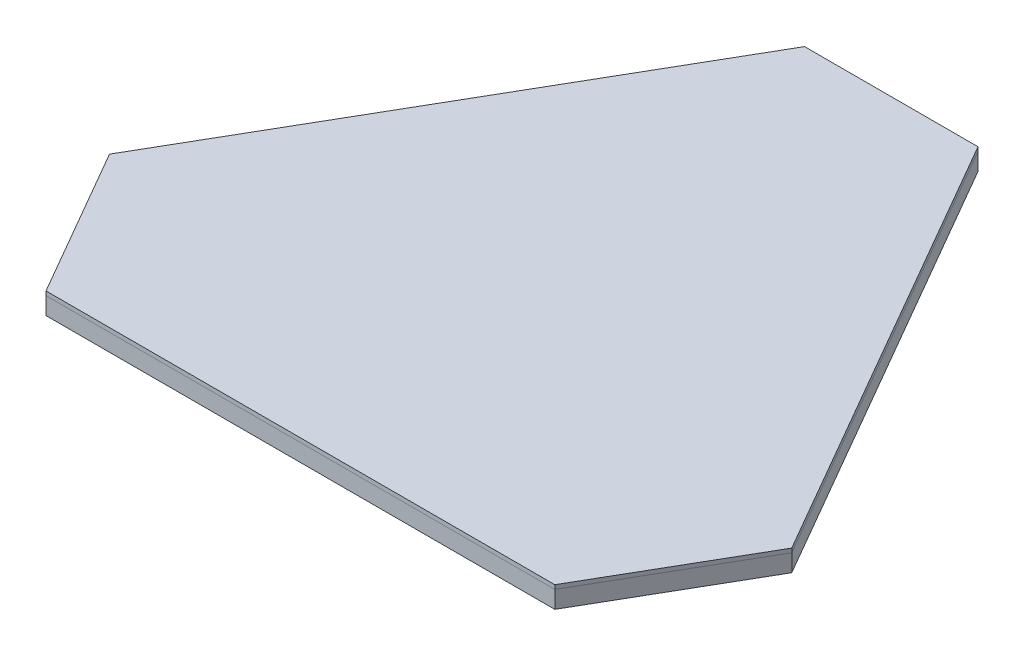
from build123d import *

# Parameters (mm, degrees)
RSC_START                   = -6.35
RSC_0_5_X_0_5_IN_1_DEPTH    = 12.7
RSC_0_5_X_0_5_IN_1_2_DEPTH  = 1
RSC_START_2                 = 5.35
RSC_0_5_X_0_5_IN_1_3_DEPTH  = 1
RSC_0_5_X_0_5_IN_1_4_DEPTH  = 12.7
RSC_0_5_X_0_5_IN_1_5_DEPTH  = 1
RSC_0_5_X_0_5_IN_1_6_DEPTH  = 1
RSC_0_5_X_0_5_IN_1_7_DEPTH  = 12.7
RSC_0_5_X_0_5_IN_1_8_DEPTH  = 1
RSC_0_5_X_0_5_IN_1_9_DEPTH  = 1
RSC_0_5_X_0_5_IN_1_10_DEPTH = 12.7
RSC_0_5_X_0_5_IN_1_11_DEPTH = 1
RSC_0_5_X_0_5_IN_1_12_DEPTH = 1
RSC_0_5_X_0_5_IN_1_13_DEPTH = 12.7
RSC_0_5_X_0_5_IN_1_14_DEPTH = 1
RSC_0_5_X_0_5_IN_1_15_DEPTH = 1
RSC_0_5_X_0_5_IN_1_16_DEPTH = 12.7
RSC_0_5_X_0_5_IN_1_17_DEPTH = 1
RSC_0_5_X_0_5_IN_1_18_DEPTH = 1
RSC_0_5_X_0_5_IN_1_19_DEPTH = 12.7
RSC_0_5_X_0_5_IN_1_20_DEPTH = 1
RSC_0_5_X_0_5_IN_1_21_DEPTH = 1
RSC_0_5_X_0_5_IN_1_22_DEPTH = 12.7
RSC_0_5_X_0_5_IN_1_23_DEPTH = 1
RSC_0_5_X_0_5_IN_1_24_DEPTH = 1
RSC_0_5_X_0_5_IN_1_25_DEPTH = 12.7
RSC_0_5_X_0_5_IN_1_26_DEPTH = 1
RSC_0_5_X_0_5_IN_1_27_DEPTH = 1
RSC_0_5_X_0_5_IN_1_28_DEPTH = 12.7
RSC_0_5_X_0_5_IN_1_29_DEPTH = 1
RSC_0_5_X_0_5_IN_1_30_DEPTH = 1
SKETCH12_R                  = 3.5
CUT_EXTRUDE1_DEPTH          = 356.811003808
CUT_EXTRUDE3_REACH          = 505.683
SKETCH14_R                  = 2
CUT_EXTRUDE5_REACH          = 491.99
SKETCH16_R                  = 2.5
CUT_EXTRUDE6_REACH          = 495.439
SKETCH17_R                  = 2.5
BOSS_EXTRUDE1_DEPTH         = 3


# Read off the part's stored shape, not the designer's step: Rsc 0.5 X 0.5 IN(1)
with BuildPart() as part:
    # Rsc 0.5 X 0.5 IN(1) outline → Rsc 0.5 X 0.5 IN(1) (new body)
    with BuildSketch(Plane(origin=(0, 0, 0), x_dir=(1, 0, 0), z_dir=(0, 1, 0)).offset(RSC_START)):
        Polygon((63.666174209, 252.426951546), (-63.666174209, 252.426951546), (-63.08882394, 251.426951546), (63.08882394, 251.426951546), align=None)
        Polygon((56.91117606, 240.726951546), (-56.91117606, 240.726951546), (-56.333825791, 239.726951546), (56.333825791, 239.726951546), align=None)
    extrude(amount=RSC_0_5_X_0_5_IN_1_DEPTH)

    # Rsc 0.5 X 0.5 IN_1 2 outline → Rsc 0.5 X 0.5 IN_1 2 (add)
    with BuildSketch(Plane(origin=(0, 0, 0), x_dir=(1, 0, 0), z_dir=(0, 1, 0)).offset(RSC_START)):
        Polygon((63.08882394, 251.426951546), (-63.08882394, 251.426951546), (-56.91117606, 240.726951546), (56.91117606, 240.726951546), align=None)
    extrude(amount=RSC_0_5_X_0_5_IN_1_2_DEPTH)

    # Rsc 0.5 X 0.5 IN_1 3 outline → Rsc 0.5 X 0.5 IN_1 3 (add)
    with BuildSketch(Plane(origin=(0, 0, 0), x_dir=(1, 0, 0), z_dir=(0, 1, 0)).offset(RSC_START_2)):
        Polygon((63.08882394, 251.426951546), (-63.08882394, 251.426951546), (-56.91117606, 240.726951546), (56.91117606, 240.726951546), align=None)
    extrude(amount=RSC_0_5_X_0_5_IN_1_3_DEPTH)


with BuildPart() as body_2:
    # Rsc 0.5 X 0.5 IN_1 4 outline → Rsc 0.5 X 0.5 IN_1 4 (new body)
    with BuildSketch(Plane(origin=(0, 0, 0), x_dir=(1, 0, 0), z_dir=(0, 1, 0)).offset(RSC_START)):
        Polygon((-63.666174209, 252.426951546), (-250.441239743, -71.076951546), (-249.286539205, -71.076951546), (-63.08882394, 251.426951546), align=None)
        Polygon((-56.91117606, 240.726951546), (-236.931243444, -71.076951546), (-235.776542906, -71.076951546), (-56.333825791, 239.726951546), align=None)
    extrude(amount=RSC_0_5_X_0_5_IN_1_4_DEPTH)

    # Rsc 0.5 X 0.5 IN_1 5 outline → Rsc 0.5 X 0.5 IN_1 5 (add)
    with BuildSketch(Plane(origin=(0, 0, 0), x_dir=(1, 0, 0), z_dir=(0, 1, 0)).offset(RSC_START)):
        Polygon((-63.08882394, 251.426951546), (-249.286539205, -71.076951546), (-236.931243444, -71.076951546), (-56.91117606, 240.726951546), align=None)
    extrude(amount=RSC_0_5_X_0_5_IN_1_5_DEPTH)

    # Rsc 0.5 X 0.5 IN_1 6 outline → Rsc 0.5 X 0.5 IN_1 6 (add)
    with BuildSketch(Plane(origin=(0, 0, 0), x_dir=(1, 0, 0), z_dir=(0, 1, 0)).offset(RSC_START_2)):
        Polygon((-63.08882394, 251.426951546), (-249.286539205, -71.076951546), (-236.931243444, -71.076951546), (-56.91117606, 240.726951546), align=None)
    extrude(amount=RSC_0_5_X_0_5_IN_1_6_DEPTH)

    # Cut-Extrude5: up to this face of the body (flat: up to its plane)
    cut_extrude5_end = Plane(body_2.part.faces().sort_by_distance((-146.055184349, 0, -84.325))[0])
    # Sketch16 → Cut-Extrude5 (cut, up to the picked face)
    with BuildSketch(Plane(origin=(-157.053706976, 0, -90.675), x_dir=(-0.4999999999999974, 0, 0.8660254037844403), z_dir=(-0.8660254037844402, 0, -0.49999999999999734)), mode=Mode.PRIVATE) as cut_extrude5_sk1:
        with Locations((-46.775065534, 0)):
            Circle(SKETCH16_R)
    cut_extrude5_tool1 = split(extrude(cut_extrude5_sk1.sketch, amount=-CUT_EXTRUDE5_REACH, mode=Mode.PRIVATE), bisect_by=cut_extrude5_end, keep=Keep.BOTH, mode=Mode.PRIVATE)
    # Sketch16 → Cut-Extrude5 (cut, up to the picked face)
    with BuildSketch(Plane(origin=(-157.053706976, 0, -90.675), x_dir=(-0.4999999999999974, 0, 0.8660254037844403), z_dir=(-0.8660254037844402, 0, -0.49999999999999734)), mode=Mode.PRIVATE) as cut_extrude5_sk2:
        with Locations((-14.775065534, 0)):
            Circle(SKETCH16_R)
    cut_extrude5_tool2 = split(extrude(cut_extrude5_sk2.sketch, amount=-CUT_EXTRUDE5_REACH, mode=Mode.PRIVATE), bisect_by=cut_extrude5_end, keep=Keep.BOTH, mode=Mode.PRIVATE)
    add(cut_extrude5_tool1.solids().sort_by(Axis((-133.666174, 0, -131.183395), (0.8660254037844402, 0, 0.49999999999999734)))[0], mode=Mode.SUBTRACT)
    add(cut_extrude5_tool2.solids().sort_by(Axis((-149.666174, 0, -103.470582), (0.8660254037844402, 0, 0.49999999999999734)))[0], mode=Mode.SUBTRACT)


with BuildPart() as body_3:
    # Rsc 0.5 X 0.5 IN_1 7 outline → Rsc 0.5 X 0.5 IN_1 7 (new body)
    with BuildSketch(Plane(origin=(0, 0, 0), x_dir=(1, 0, 0), z_dir=(0, 1, 0)).offset(RSC_START)):
        Polygon((250.441239743, -71.076951546), (63.666174209, 252.426951546), (63.08882394, 251.426951546), (249.286539205, -71.076951546), align=None)
        Polygon((236.931243444, -71.076951546), (56.91117606, 240.726951546), (56.333825791, 239.726951546), (235.776542906, -71.076951546), align=None)
    extrude(amount=RSC_0_5_X_0_5_IN_1_7_DEPTH)

    # Rsc 0.5 X 0.5 IN_1 8 outline → Rsc 0.5 X 0.5 IN_1 8 (add)
    with BuildSketch(Plane(origin=(0, 0, 0), x_dir=(1, 0, 0), z_dir=(0, 1, 0)).offset(RSC_START)):
        Polygon((249.286539205, -71.076951546), (63.08882394, 251.426951546), (56.91117606, 240.726951546), (236.931243444, -71.076951546), align=None)
    extrude(amount=RSC_0_5_X_0_5_IN_1_8_DEPTH)

    # Rsc 0.5 X 0.5 IN_1 9 outline → Rsc 0.5 X 0.5 IN_1 9 (add)
    with BuildSketch(Plane(origin=(0, 0, 0), x_dir=(1, 0, 0), z_dir=(0, 1, 0)).offset(RSC_START_2)):
        Polygon((249.286539205, -71.076951546), (63.08882394, 251.426951546), (56.91117606, 240.726951546), (236.931243444, -71.076951546), align=None)
    extrude(amount=RSC_0_5_X_0_5_IN_1_9_DEPTH)


with BuildPart() as body_4:
    # Rsc 0.5 X 0.5 IN_1 10 outline → Rsc 0.5 X 0.5 IN_1 10 (new body)
    with BuildSketch(Plane(origin=(0, 0, 0), x_dir=(1, 0, 0), z_dir=(0, 1, 0)).offset(RSC_START)):
        Polygon((186.775065534, -181.35), (250.441239743, -71.076951546), (249.286539205, -71.076951546), (186.197715265, -180.35), align=None)
        Polygon((180.020067384, -169.65), (236.931243444, -71.076951546), (235.776542906, -71.076951546), (179.442717115, -168.65), align=None)
    extrude(amount=RSC_0_5_X_0_5_IN_1_10_DEPTH)

    # Rsc 0.5 X 0.5 IN_1 11 outline → Rsc 0.5 X 0.5 IN_1 11 (add)
    with BuildSketch(Plane(origin=(0, 0, 0), x_dir=(1, 0, 0), z_dir=(0, 1, 0)).offset(RSC_START)):
        Polygon((186.197715265, -180.35), (249.286539205, -71.076951546), (236.931243444, -71.076951546), (180.020067384, -169.65), align=None)
    extrude(amount=RSC_0_5_X_0_5_IN_1_11_DEPTH)

    # Rsc 0.5 X 0.5 IN_1 12 outline → Rsc 0.5 X 0.5 IN_1 12 (add)
    with BuildSketch(Plane(origin=(0, 0, 0), x_dir=(1, 0, 0), z_dir=(0, 1, 0)).offset(RSC_START_2)):
        Polygon((186.197715265, -180.35), (249.286539205, -71.076951546), (236.931243444, -71.076951546), (180.020067384, -169.65), align=None)
    extrude(amount=RSC_0_5_X_0_5_IN_1_12_DEPTH)


with BuildPart() as body_5:
    # Rsc 0.5 X 0.5 IN_1 13 outline → Rsc 0.5 X 0.5 IN_1 13 (new body)
    with BuildSketch(Plane(origin=(0, 0, 0), x_dir=(1, 0, 0), z_dir=(0, 1, 0)).offset(RSC_START)):
        Polygon((-186.775065534, -181.35), (186.775065534, -181.35), (186.197715265, -180.35), (-186.197715265, -180.35), align=None)
        Polygon((-180.020067384, -169.65), (180.020067384, -169.65), (179.442717115, -168.65), (-179.442717115, -168.65), align=None)
    extrude(amount=RSC_0_5_X_0_5_IN_1_13_DEPTH)

    # Rsc 0.5 X 0.5 IN_1 14 outline → Rsc 0.5 X 0.5 IN_1 14 (add)
    with BuildSketch(Plane(origin=(0, 0, 0), x_dir=(1, 0, 0), z_dir=(0, 1, 0)).offset(RSC_START)):
        Polygon((-186.197715265, -180.35), (186.197715265, -180.35), (180.020067384, -169.65), (-180.020067384, -169.65), align=None)
    extrude(amount=RSC_0_5_X_0_5_IN_1_14_DEPTH)

    # Rsc 0.5 X 0.5 IN_1 15 outline → Rsc 0.5 X 0.5 IN_1 15 (add)
    with BuildSketch(Plane(origin=(0, 0, 0), x_dir=(1, 0, 0), z_dir=(0, 1, 0)).offset(RSC_START_2)):
        Polygon((-186.197715265, -180.35), (186.197715265, -180.35), (180.020067384, -169.65), (-180.020067384, -169.65), align=None)
    extrude(amount=RSC_0_5_X_0_5_IN_1_15_DEPTH)


with BuildPart() as body_6:
    # Rsc 0.5 X 0.5 IN_1 16 outline → Rsc 0.5 X 0.5 IN_1 16 (new body)
    with BuildSketch(Plane(origin=(0, 0, 0), x_dir=(1, 0, 0), z_dir=(0, 1, 0)).offset(RSC_START)):
        Polygon((-250.441239743, -71.076951546), (-186.775065534, -181.35), (-186.197715265, -180.35), (-249.286539205, -71.076951546), align=None)
        Polygon((-236.931243444, -71.076951546), (-180.020067384, -169.65), (-179.442717115, -168.65), (-235.776542906, -71.076951546), align=None)
    extrude(amount=RSC_0_5_X_0_5_IN_1_16_DEPTH)

    # Rsc 0.5 X 0.5 IN_1 17 outline → Rsc 0.5 X 0.5 IN_1 17 (add)
    with BuildSketch(Plane(origin=(0, 0, 0), x_dir=(1, 0, 0), z_dir=(0, 1, 0)).offset(RSC_START)):
        Polygon((-249.286539205, -71.076951546), (-186.197715265, -180.35), (-180.020067384, -169.65), (-236.931243444, -71.076951546), align=None)
    extrude(amount=RSC_0_5_X_0_5_IN_1_17_DEPTH)

    # Rsc 0.5 X 0.5 IN_1 18 outline → Rsc 0.5 X 0.5 IN_1 18 (add)
    with BuildSketch(Plane(origin=(0, 0, 0), x_dir=(1, 0, 0), z_dir=(0, 1, 0)).offset(RSC_START_2)):
        Polygon((-249.286539205, -71.076951546), (-186.197715265, -180.35), (-180.020067384, -169.65), (-236.931243444, -71.076951546), align=None)
    extrude(amount=RSC_0_5_X_0_5_IN_1_18_DEPTH)


with BuildPart() as body_7:
    # Rsc 0.5 X 0.5 IN_1 19 outline → Rsc 0.5 X 0.5 IN_1 19 (new body)
    with BuildSketch(Plane(origin=(0, 0, 0), x_dir=(1, 0, 0), z_dir=(0, 1, 0)).offset(RSC_START)):
        Polygon((107.094461227, 151.806951946), (-107.094461227, 151.806951946), (-107.671811496, 150.806951946), (107.671811496, 150.806951946), align=None)
        Polygon((113.849459376, 140.106951946), (-113.849459376, 140.106951946), (-114.426809646, 139.106951946), (114.426809646, 139.106951946), align=None)
    extrude(amount=RSC_0_5_X_0_5_IN_1_19_DEPTH)

    # Rsc 0.5 X 0.5 IN_1 20 outline → Rsc 0.5 X 0.5 IN_1 20 (add)
    with BuildSketch(Plane(origin=(0, 0, 0), x_dir=(1, 0, 0), z_dir=(0, 1, 0)).offset(RSC_START)):
        Polygon((107.671811496, 150.806951946), (-107.671811496, 150.806951946), (-113.849459377, 140.106951946), (113.849459376, 140.106951946), align=None)
    extrude(amount=RSC_0_5_X_0_5_IN_1_20_DEPTH)

    # Rsc 0.5 X 0.5 IN_1 21 outline → Rsc 0.5 X 0.5 IN_1 21 (add)
    with BuildSketch(Plane(origin=(0, 0, 0), x_dir=(1, 0, 0), z_dir=(0, 1, 0)).offset(RSC_START_2)):
        Polygon((107.671811496, 150.806951946), (-107.671811496, 150.806951946), (-113.849459377, 140.106951946), (113.849459376, 140.106951946), align=None)
    extrude(amount=RSC_0_5_X_0_5_IN_1_21_DEPTH)


with BuildPart() as body_8:
    # Rsc 0.5 X 0.5 IN_1 22 outline → Rsc 0.5 X 0.5 IN_1 22 (new body)
    with BuildSketch(Plane(origin=(0, 0, 0), x_dir=(1, 0, 0), z_dir=(0, 1, 0)).offset(RSC_START)):
        Polygon((-63.256749405, -168.65), (-177.683559051, 29.543048054), (-178.26090932, 28.543048054), (-64.411449944, -168.65), align=None)
        Polygon((-76.766745704, -168.65), (-184.4385572, 17.843048054), (-185.01590747, 16.843048054), (-77.921446243, -168.65), align=None)
    extrude(amount=RSC_0_5_X_0_5_IN_1_22_DEPTH)

    # Rsc 0.5 X 0.5 IN_1 23 outline → Rsc 0.5 X 0.5 IN_1 23 (add)
    with BuildSketch(Plane(origin=(0, 0, 0), x_dir=(1, 0, 0), z_dir=(0, 1, 0)).offset(RSC_START)):
        Polygon((-64.411449944, -168.65), (-178.26090932, 28.543048054), (-184.438557201, 17.843048054), (-76.766745704, -168.65), align=None)
    extrude(amount=RSC_0_5_X_0_5_IN_1_23_DEPTH)

    # Rsc 0.5 X 0.5 IN_1 24 outline → Rsc 0.5 X 0.5 IN_1 24 (add)
    with BuildSketch(Plane(origin=(0, 0, 0), x_dir=(1, 0, 0), z_dir=(0, 1, 0)).offset(RSC_START_2)):
        Polygon((-64.411449944, -168.65), (-178.26090932, 28.543048054), (-184.438557201, 17.843048054), (-76.766745704, -168.65), align=None)
    extrude(amount=RSC_0_5_X_0_5_IN_1_24_DEPTH)


with BuildPart() as body_9:
    # Rsc 0.5 X 0.5 IN_1 25 outline → Rsc 0.5 X 0.5 IN_1 25 (new body)
    with BuildSketch(Plane(origin=(0, 0, 0), x_dir=(1, 0, 0), z_dir=(0, 1, 0)).offset(RSC_START)):
        Polygon((77.921446243, -168.65), (185.01590747, 16.843048054), (184.438557201, 17.843048054), (76.766745704, -168.65), align=None)
        Polygon((64.411449944, -168.65), (178.26090932, 28.543048054), (177.683559051, 29.543048054), (63.256749405, -168.65), align=None)
    extrude(amount=RSC_0_5_X_0_5_IN_1_25_DEPTH)

    # Rsc 0.5 X 0.5 IN_1 26 outline → Rsc 0.5 X 0.5 IN_1 26 (add)
    with BuildSketch(Plane(origin=(0, 0, 0), x_dir=(1, 0, 0), z_dir=(0, 1, 0)).offset(RSC_START)):
        Polygon((76.766745704, -168.65), (184.4385572, 17.843048054), (178.26090932, 28.543048054), (64.411449944, -168.65), align=None)
    extrude(amount=RSC_0_5_X_0_5_IN_1_26_DEPTH)

    # Rsc 0.5 X 0.5 IN_1 27 outline → Rsc 0.5 X 0.5 IN_1 27 (add)
    with BuildSketch(Plane(origin=(0, 0, 0), x_dir=(1, 0, 0), z_dir=(0, 1, 0)).offset(RSC_START_2)):
        Polygon((76.766745704, -168.65), (184.4385572, 17.843048054), (178.26090932, 28.543048054), (64.411449944, -168.65), align=None)
    extrude(amount=RSC_0_5_X_0_5_IN_1_27_DEPTH)

    # Cut-Extrude3: up to this face of the body (flat: up to its plane)
    cut_extrude3_end = Plane(body_9.part.faces().sort_by_distance((120.470154228, 0, 69.553475973))[0])
    # Sketch14 → Cut-Extrude3 (cut, up to the picked face)
    with BuildSketch(Plane(origin=(131.468676856, 0, 75.903475973), x_dir=(0.4999999999999979, 0, -0.8660254037844399), z_dir=(0.8660254037844398, 0, 0.49999999999999784)), mode=Mode.PRIVATE) as cut_extrude3_sk1:
        with Locations((-20, 0.027919498)):
            Circle(SKETCH14_R)
    cut_extrude3_tool1 = split(extrude(cut_extrude3_sk1.sketch, amount=-CUT_EXTRUDE3_REACH, mode=Mode.PRIVATE), bisect_by=cut_extrude3_end, keep=Keep.BOTH, mode=Mode.PRIVATE)
    # Sketch14 → Cut-Extrude3 (cut, up to the picked face)
    with BuildSketch(Plane(origin=(131.468676856, 0, 75.903475973), x_dir=(0.4999999999999979, 0, -0.8660254037844399), z_dir=(0.8660254037844398, 0, 0.49999999999999784)), mode=Mode.PRIVATE) as cut_extrude3_sk2:
        with Locations((20, 0.027919498)):
            Circle(SKETCH14_R)
    cut_extrude3_tool2 = split(extrude(cut_extrude3_sk2.sketch, amount=-CUT_EXTRUDE3_REACH, mode=Mode.PRIVATE), bisect_by=cut_extrude3_end, keep=Keep.BOTH, mode=Mode.PRIVATE)
    add(cut_extrude3_tool1.solids().sort_by(Axis((121.468677, 0.027919, 93.223984), (-0.8660254037844398, 0, -0.49999999999999784)))[0], mode=Mode.SUBTRACT)
    add(cut_extrude3_tool2.solids().sort_by(Axis((141.468677, 0.027919, 58.582968), (-0.8660254037844398, 0, -0.49999999999999784)))[0], mode=Mode.SUBTRACT)


with BuildPart() as body_10:
    # Rsc 0.5 X 0.5 IN_1 28 outline → Rsc 0.5 X 0.5 IN_1 28 (new body)
    with BuildSketch(Plane(origin=(0, 0, 0), x_dir=(1, 0, 0), z_dir=(0, 1, 0)).offset(RSC_START)):
        Polygon((-87.074400987, -127.396617344), (-15.621446243, -168.65), (-13.621446243, -168.65), (-88.074400987, -125.664566537), align=None)
        Polygon((-98.774400987, -107.131622896), (7.778553757, -168.65), (9.778553757, -168.65), (-99.774400987, -105.399572088), align=None)
    extrude(amount=RSC_0_5_X_0_5_IN_1_28_DEPTH)

    # Rsc 0.5 X 0.5 IN_1 29 outline → Rsc 0.5 X 0.5 IN_1 29 (add)
    with BuildSketch(Plane(origin=(0, 0, 0), x_dir=(1, 0, 0), z_dir=(0, 1, 0)).offset(RSC_START)):
        Polygon((-88.074400987, -125.664566537), (-13.621446243, -168.65), (7.778553757, -168.65), (-98.774400987, -107.131622896), align=None)
    extrude(amount=RSC_0_5_X_0_5_IN_1_29_DEPTH)

    # Rsc 0.5 X 0.5 IN_1 30 outline → Rsc 0.5 X 0.5 IN_1 30 (add)
    with BuildSketch(Plane(origin=(0, 0, 0), x_dir=(1, 0, 0), z_dir=(0, 1, 0)).offset(RSC_START_2)):
        Polygon((-88.074400987, -125.664566537), (-13.621446243, -168.65), (7.778553757, -168.65), (-98.774400987, -107.131622896), align=None)
    extrude(amount=RSC_0_5_X_0_5_IN_1_30_DEPTH)

    # Cut-Extrude6: up to this face of the body (flat: up to its plane)
    cut_extrude6_end = Plane(body_10.part.faces().sort_by_distance((-51.347923615, 0, 148.023308672))[0])
    # Sketch17 → Cut-Extrude6 (cut, up to the picked face)
    with BuildSketch(Plane(origin=(-70.582953735, 0, 122.253262017), x_dir=(-0.86602540378444, 0, -0.49999999999999756), z_dir=(0.49999999999999756, 0, -0.86602540378444)), mode=Mode.PRIVATE) as cut_extrude6_sk1:
        with Locations((-4.543048054, 0)):
            Circle(SKETCH17_R)
    cut_extrude6_tool1 = split(extrude(cut_extrude6_sk1.sketch, amount=-CUT_EXTRUDE6_REACH, mode=Mode.PRIVATE), bisect_by=cut_extrude6_end, keep=Keep.BOTH, mode=Mode.PRIVATE)
    # Sketch17 → Cut-Extrude6 (cut, up to the picked face)
    with BuildSketch(Plane(origin=(-70.582953735, 0, 122.253262017), x_dir=(-0.86602540378444, 0, -0.49999999999999756), z_dir=(0.49999999999999756, 0, -0.86602540378444)), mode=Mode.PRIVATE) as cut_extrude6_sk2:
        with Locations((-36.543048054, 0)):
            Circle(SKETCH17_R)
    cut_extrude6_tool2 = split(extrude(cut_extrude6_sk2.sketch, amount=-CUT_EXTRUDE6_REACH, mode=Mode.PRIVATE), bisect_by=cut_extrude6_end, keep=Keep.BOTH, mode=Mode.PRIVATE)
    add(cut_extrude6_tool1.solids().sort_by(Axis((-66.648559, 0, 124.524786), (-0.49999999999999756, 0, 0.86602540378444)))[0], mode=Mode.SUBTRACT)
    add(cut_extrude6_tool2.solids().sort_by(Axis((-38.935746, 0, 140.524786), (-0.49999999999999756, 0, 0.86602540378444)))[0], mode=Mode.SUBTRACT)


with BuildPart() as cut_extrude1_tool:
    # Sketch12 → Cut-Extrude1 (new, through all)
    with BuildSketch(Plane(origin=(0, 6.35, 0), x_dir=(1, 0, 0), z_dir=(0, 1, 0))):
        with Locations(Location((-227.108891325, -98.789764467, 0), (0, 0, 180))):
            Circle(SKETCH12_R)
        with Locations(Location((-199.108891325, -147.287187079, 0), (0, 0, 180))):
            Circle(SKETCH12_R)
        with Locations(Location((227.108891325, -98.789764467, 0), (0, 0, 180))):
            Circle(SKETCH12_R)
        with Locations(Location((199.108891325, -147.287187079, 0), (0, 0, 180))):
            Circle(SKETCH12_R)
        with Locations(Location((-28, 246.076951546, 0), (0, 0, 180))):
            Circle(SKETCH12_R)
        with Locations(Location((28, 246.076951546, 0), (0, 0, 180))):
            Circle(SKETCH12_R)
    extrude(amount=-CUT_EXTRUDE1_DEPTH)


with BuildPart() as part_1:
    add(part.part)

    # Cut-Extrude1: cut by cut_extrude1_tool
    add(cut_extrude1_tool.part, mode=Mode.SUBTRACT)


with BuildPart() as body_4_1:
    add(body_4.part)

    # Cut-Extrude1: cut by cut_extrude1_tool
    add(cut_extrude1_tool.part, mode=Mode.SUBTRACT)


with BuildPart() as body_6_1:
    add(body_6.part)

    # Cut-Extrude1: cut by cut_extrude1_tool
    add(cut_extrude1_tool.part, mode=Mode.SUBTRACT)


with BuildPart() as body_11:
    # Sketch18 → Boss-Extrude1 (new body)
    with BuildSketch(Plane(origin=(0, 6.35, 0), x_dir=(1, 0, 0), z_dir=(0, 1, 0))):
        Polygon((-63.666174209, 252.426951546), (63.666174209, 252.426951546), (250.441239743, -71.076951546), (186.775065534, -181.35), (-186.775065534, -181.35), (-250.441239743, -71.076951546), align=None)
    extrude(amount=BOSS_EXTRUDE1_DEPTH)


solid = Compound([body_2.part, body_3.part, body_5.part, body_7.part, body_8.part, body_9.part, body_10.part, part_1.part, body_4_1.part, body_6_1.part, body_11.part])
